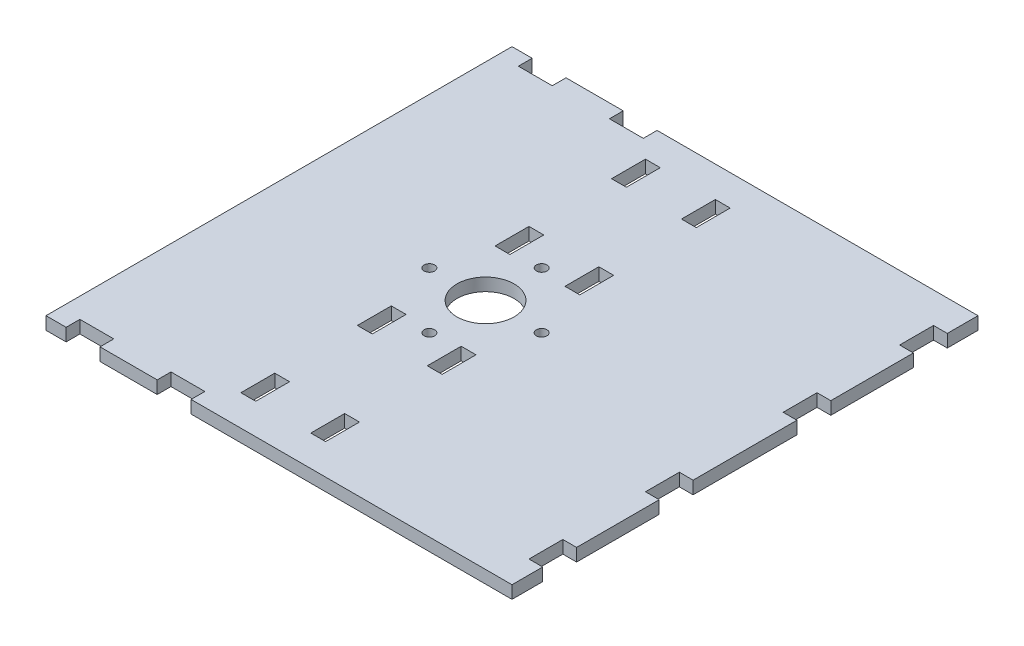
from build123d import *

# Parameters (mm, degrees)
SKETCH2_W           = 220
SKETCH2_H           = 220
BOSS_EXTRUDE1_DEPTH = 6
SKETCH3_R           = 13.5
CUT_EXTRUDE1_DEPTH  = 10
SKETCH4_R           = 2.5
CUT_EXTRUDE2_DEPTH  = 10
CAVITY1_START       = -197.339948834
CAVITY1_OUTLINE_W   = 6
CAVITY1_OUTLINE_H   = 6
CAVITY1_DEPTH       = 15
CAVITY1_START_2     = -142.339948834
CAVITY1_2_OUTLINE_W = 6
CAVITY1_2_OUTLINE_H = 6
CAVITY1_2_DEPTH     = 15
CAVITY1_START_3     = -77.339948834
CAVITY1_3_OUTLINE_W = 6
CAVITY1_3_OUTLINE_H = 6
CAVITY1_3_DEPTH     = 15
CAVITY1_START_4     = -22.339948834
CAVITY1_4_OUTLINE_W = 6
CAVITY1_4_OUTLINE_H = 6
CAVITY1_4_DEPTH     = 15
CAVITY1_START_5     = -212.339948834
CAVITY1_5_OUTLINE_W = 15
CAVITY1_5_OUTLINE_H = 6
CAVITY1_5_DEPTH     = 6
CAVITY1_START_6     = 1.660051166
CAVITY1_6_OUTLINE_W = 15
CAVITY1_6_OUTLINE_H = 6
CAVITY1_6_DEPTH     = 6
SKETCH5_W           = 6.5
SKETCH5_H           = 16
SKETCH5_W_2         = 7
SKETCH5_W_3         = 16
SKETCH5_H_2         = 6.5
CUT_EXTRUDE3_DEPTH  = 10


# Read off the part's stored shape, not the designer's step: Cavity1
with BuildPart() as part:
    # Sketch2 → Boss-Extrude1 (new body)
    with BuildSketch(Plane(origin=(0, 0, 0), x_dir=(1, 0, 0), z_dir=(0, 1, 0))):
        with Locations((-604.222894392, 102.339948834)):
            Rectangle(SKETCH2_W, SKETCH2_H)
    extrude(amount=BOSS_EXTRUDE1_DEPTH)

    # Sketch3 → Cut-Extrude1 (cut)
    with BuildSketch(Plane(origin=(0, 6, 0), x_dir=(1, 0, 0), z_dir=(0, 1, 0))):
        with Locations(Location((-616.722894392, 102.339948834, 0), (0, 0, 270))):
            Circle(SKETCH3_R)
    extrude(amount=-CUT_EXTRUDE1_DEPTH, mode=Mode.SUBTRACT)

    # Sketch4 → Cut-Extrude2 (cut)
    with BuildSketch(Plane(origin=(0, 6, 0), x_dir=(1, 0, 0), z_dir=(0, 1, 0))):
        with Locations(Location((-590.222894392, 102.339948834, 0), (0, 0, 270))):
            Circle(SKETCH4_R)
        with Locations(Location((-616.722894392, 128.839948834, 0), (0, 0, 270))):
            Circle(SKETCH4_R)
        with Locations(Location((-643.222894392, 102.339948834, 0), (0, 0, 270))):
            Circle(SKETCH4_R)
        with Locations(Location((-616.722894392, 75.839948834, 0), (0, 0, 270))):
            Circle(SKETCH4_R)
    extrude(amount=-CUT_EXTRUDE2_DEPTH, mode=Mode.SUBTRACT)

    # Cavity1 outline → Cavity1 (cut)
    with BuildSketch(Plane.XY.offset(CAVITY1_START)):
        with Locations((-633.222894392, 3)):
            Rectangle(CAVITY1_OUTLINE_W, CAVITY1_OUTLINE_H)
        with Locations((-600.222894392, 3)):
            Rectangle(CAVITY1_OUTLINE_W, CAVITY1_OUTLINE_H)
        with Locations((-497.222894392, 3)):
            Rectangle(CAVITY1_OUTLINE_W, CAVITY1_OUTLINE_H)
    extrude(amount=CAVITY1_DEPTH, mode=Mode.SUBTRACT)

    # Cavity1 2 outline → Cavity1 2 (cut)
    with BuildSketch(Plane.XY.offset(CAVITY1_START_2)):
        with Locations((-633.222894392, 3)):
            Rectangle(CAVITY1_2_OUTLINE_W, CAVITY1_2_OUTLINE_H)
        with Locations((-600.222894392, 3)):
            Rectangle(CAVITY1_2_OUTLINE_W, CAVITY1_2_OUTLINE_H)
        with Locations((-497.222894392, 3)):
            Rectangle(CAVITY1_2_OUTLINE_W, CAVITY1_2_OUTLINE_H)
    extrude(amount=CAVITY1_2_DEPTH, mode=Mode.SUBTRACT)

    # Cavity1 3 outline → Cavity1 3 (cut)
    with BuildSketch(Plane.XY.offset(CAVITY1_START_3)):
        with Locations((-633.222894392, 3)):
            Rectangle(CAVITY1_3_OUTLINE_W, CAVITY1_3_OUTLINE_H)
        with Locations((-600.222894392, 3)):
            Rectangle(CAVITY1_3_OUTLINE_W, CAVITY1_3_OUTLINE_H)
        with Locations((-497.222894392, 3)):
            Rectangle(CAVITY1_3_OUTLINE_W, CAVITY1_3_OUTLINE_H)
    extrude(amount=CAVITY1_3_DEPTH, mode=Mode.SUBTRACT)

    # Cavity1 4 outline → Cavity1 4 (cut)
    with BuildSketch(Plane.XY.offset(CAVITY1_START_4)):
        with Locations((-633.222894392, 3)):
            Rectangle(CAVITY1_4_OUTLINE_W, CAVITY1_4_OUTLINE_H)
        with Locations((-600.222894392, 3)):
            Rectangle(CAVITY1_4_OUTLINE_W, CAVITY1_4_OUTLINE_H)
        with Locations((-497.222894392, 3)):
            Rectangle(CAVITY1_4_OUTLINE_W, CAVITY1_4_OUTLINE_H)
    extrude(amount=CAVITY1_4_DEPTH, mode=Mode.SUBTRACT)

    # Cavity1 5 outline → Cavity1 5 (cut)
    with BuildSketch(Plane.XY.offset(CAVITY1_START_5)):
        with Locations((-653.722894392, 3)):
            Rectangle(CAVITY1_5_OUTLINE_W, CAVITY1_5_OUTLINE_H)
        with Locations((-696.722894392, 3)):
            Rectangle(CAVITY1_5_OUTLINE_W, CAVITY1_5_OUTLINE_H)
    extrude(amount=CAVITY1_5_DEPTH, mode=Mode.SUBTRACT)

    # Cavity1 6 outline → Cavity1 6 (cut)
    with BuildSketch(Plane.XY.offset(CAVITY1_START_6)):
        with Locations((-653.722894392, 3)):
            Rectangle(CAVITY1_6_OUTLINE_W, CAVITY1_6_OUTLINE_H)
        with Locations((-696.722894392, 3)):
            Rectangle(CAVITY1_6_OUTLINE_W, CAVITY1_6_OUTLINE_H)
    extrude(amount=CAVITY1_6_DEPTH, mode=Mode.SUBTRACT)

    # Sketch5 → Cut-Extrude3 (cut)
    with BuildSketch(Plane(origin=(0, 6, 0), x_dir=(1, 0, 0), z_dir=(0, 1, 0))):
        with Locations((-497.472894392, 14.839948834)):
            Rectangle(SKETCH5_W, SKETCH5_H)
        with Locations((-497.472894392, 69.839948834)):
            Rectangle(SKETCH5_W, SKETCH5_H)
        with Locations((-497.472894392, 134.839948834)):
            Rectangle(SKETCH5_W, SKETCH5_H)
        with Locations((-497.472894392, 189.839948834)):
            Rectangle(SKETCH5_W, SKETCH5_H)
        with Locations((-600.222894392, 189.839948834)):
            Rectangle(SKETCH5_W_2, SKETCH5_H)
        with Locations((-633.222894392, 189.839948834)):
            Rectangle(SKETCH5_W_2, SKETCH5_H)
        with Locations((-600.222894392, 134.839948834)):
            Rectangle(SKETCH5_W_2, SKETCH5_H)
        with Locations((-600.222894392, 69.839948834)):
            Rectangle(SKETCH5_W_2, SKETCH5_H)
        with Locations((-600.222894392, 14.839948834)):
            Rectangle(SKETCH5_W_2, SKETCH5_H)
        with Locations((-633.222894392, 134.839948834)):
            Rectangle(SKETCH5_W_2, SKETCH5_H)
        with Locations((-633.222894392, 69.839948834)):
            Rectangle(SKETCH5_W_2, SKETCH5_H)
        with Locations((-633.222894392, 14.839948834)):
            Rectangle(SKETCH5_W_2, SKETCH5_H)
        with Locations((-653.722894392, 209.089948834)):
            Rectangle(SKETCH5_W_3, SKETCH5_H_2)
        with Locations((-696.722894392, 209.089948834)):
            Rectangle(SKETCH5_W_3, SKETCH5_H_2)
        with Locations((-653.722894392, -4.410051166)):
            Rectangle(SKETCH5_W_3, SKETCH5_H_2)
        with Locations((-696.722894392, -4.410051166)):
            Rectangle(SKETCH5_W_3, SKETCH5_H_2)
    extrude(amount=-CUT_EXTRUDE3_DEPTH, mode=Mode.SUBTRACT)


solid = part.part
